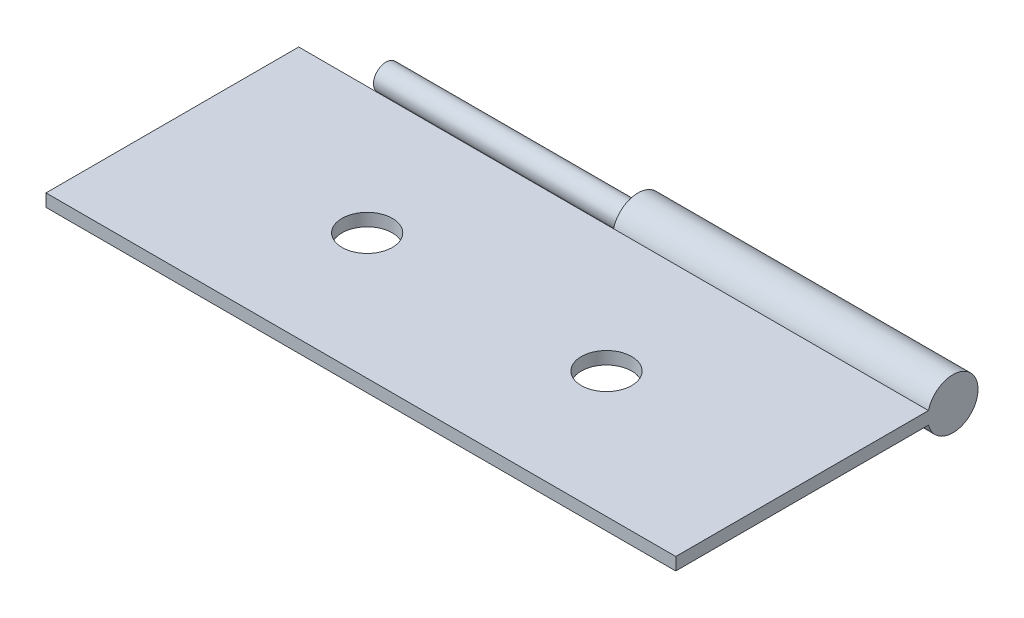
from build123d import *

# Parameters (mm, degrees)
SKETCH1_W                = 50
SKETCH1_H                = 20
BOSS_EXTRUDE1_DEPTH      = 0.5
SKETCH2_R                = 2
BOSS_EXTRUDE2_DEPTH      = 25
SKETCH3_R                = 1
BOSS_EXTRUDE3_DEPTH      = 20
BOSS_EXTRUDE4_REACH      = 34.078
BOSS_EXTRUDE4_END_RADIUS = 2
SKETCH4_W                = 50
SKETCH4_H                = 1
SKETCH5_R                = 2
CUT_EXTRUDE1_DEPTH       = 29.761954037


with BuildPart() as part:
    # Sketch1 → Boss-Extrude1 (new, symmetric)
    with BuildSketch(Plane(origin=(0, 0, 0), x_dir=(1, 0, 0), z_dir=(0, 1, 0))):
        Rectangle(SKETCH1_W, SKETCH1_H)
    extrude(amount=BOSS_EXTRUDE1_DEPTH, both=True)



with BuildPart() as body_2:
    # Sketch2 → Boss-Extrude2 (new body)
    with BuildSketch(Plane(origin=(25, 0, 0), x_dir=(0, 0, -1), z_dir=(1, 0, 0))):
        with Locations((12, 0)):
            Circle(SKETCH2_R)
    extrude(amount=-BOSS_EXTRUDE2_DEPTH)

    # Sketch3 → Boss-Extrude3 (add)
    with BuildSketch(Plane.ZY):
        with Locations((-12, 0)):
            Circle(SKETCH3_R)
    extrude(amount=BOSS_EXTRUDE3_DEPTH)


with BuildPart() as part_1:
    add(part.part)

    add(body_2.part)  # Boss-Extrude4 merges body 2
    # Boss-Extrude4: up to this cylinder (the profile starts outside it)
    boss_extrude4_end = Plane(origin=(0, 0, -12), z_dir=(1, 0, 0)) * Cylinder(BOSS_EXTRUDE4_END_RADIUS, 73.156, mode=Mode.PRIVATE)
    # Sketch4 → Boss-Extrude4 (add, up to the surface)
    with BuildSketch(Plane(origin=(0, 0, -10), x_dir=(-1, 0, 0), z_dir=(0, 0, -1)), mode=Mode.PRIVATE) as boss_extrude4_sk1:
        Rectangle(SKETCH4_W, SKETCH4_H)
    boss_extrude4_tool1 = extrude(boss_extrude4_sk1.sketch, amount=BOSS_EXTRUDE4_REACH, mode=Mode.PRIVATE) - boss_extrude4_end
    add(boss_extrude4_tool1.solids().sort_by_distance((0, 0, -10))[0])
    add(boss_extrude4_tool1.solids().sort_by_distance((0, 0, -10))[1])

    # Sketch5 → Cut-Extrude1 (cut, through all)
    with BuildSketch(Plane(origin=(0, 0.5, 0), x_dir=(1, 0, 0), z_dir=(0, 1, 0))):
        with Locations((9.5, 0)):
            Circle(SKETCH5_R)
        with Locations((-9.5, 0)):
            Circle(SKETCH5_R)
    extrude(amount=-CUT_EXTRUDE1_DEPTH, mode=Mode.SUBTRACT)


solid = part_1.part
